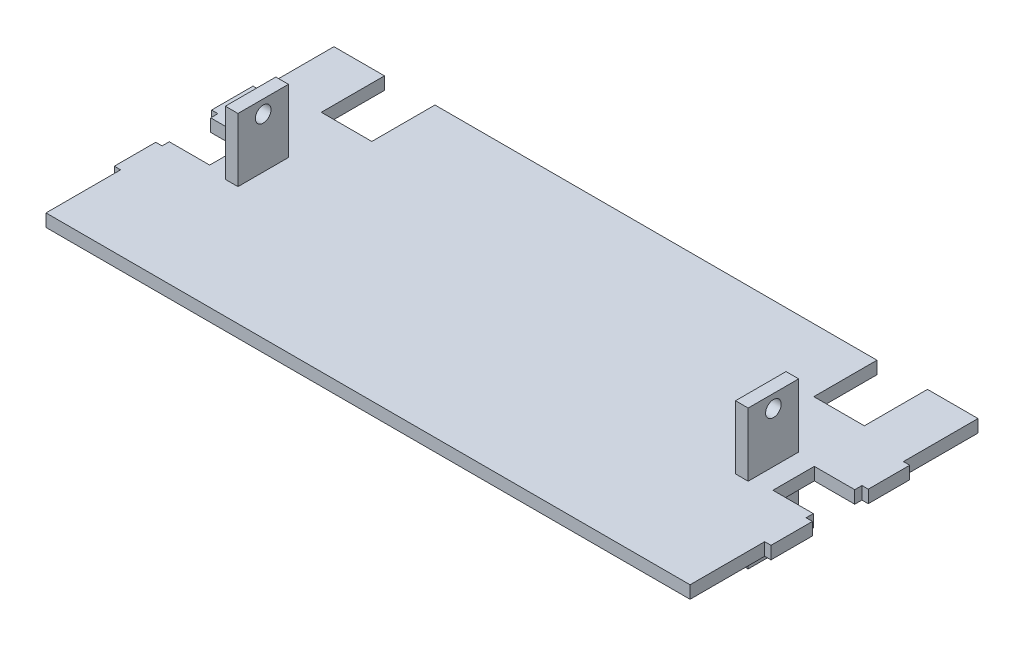
from build123d import *

# Parameters (mm, degrees)
BOSS_EXTRUDE1_DEPTH     = 3.175
SKETCH2_W               = 6.35
SKETCH2_H               = 25.4
BOSS_EXTRUDE2_DEPTH     = 35.052
CUT_EXTRUDE1_DEPTH      = 308.258672504
CUT_EXTRUDE1_DEPTH_BACK = 308.258672504
SKETCH3_R               = 3.937


with BuildPart() as part:
    # Sketch1 → Boss-Extrude1 (new, symmetric)
    with BuildSketch(Plane(origin=(0, 0, 0), x_dir=(1, 0, 0), z_dir=(0, 1, 0))):
        Polygon((161.925, -72.39), (-161.925, -72.39), (-161.925, -34.874677354), (-165.1, -34.874677354), (-165.1, -14.046677354), (-161.925, -14.046677354), (-161.925, -10.414), (-141.605, -10.414), (-141.605, 10.414), (-161.925, 10.414), (-161.925, 14.046677354), (-165.1, 14.046677354), (-165.1, 34.874677354), (-161.925, 34.874677354), (-161.925, 72.39), (-136.525, 72.39), (-136.525, 40.64), (-111.125, 40.64), (-111.125, 72.39), (111.125, 72.39), (111.125, 40.64), (136.525, 40.64), (136.525, 72.39), (161.925, 72.39), (161.925, 34.874677354), (165.1, 34.874677354), (165.1, 14.046677354), (161.925, 14.046677354), (161.925, 10.414), (141.605, 10.414), (141.605, -10.414), (161.925, -10.414), (161.925, -14.046677354), (165.1, -14.046677354), (165.1, -34.874677354), (161.925, -34.874677354), align=None)
    extrude(amount=BOSS_EXTRUDE1_DEPTH, both=True)

    # Sketch2 → Boss-Extrude2 (add, symmetric)
    with BuildSketch(Plane(origin=(0, 0, 0), x_dir=(1, 0, 0), z_dir=(0, 1, 0))):
        with Locations((128.27, 0)):
            Rectangle(SKETCH2_W, SKETCH2_H)
        with Locations((-128.27, 0)):
            Rectangle(SKETCH2_W, SKETCH2_H)
    extrude(amount=BOSS_EXTRUDE2_DEPTH, both=True)

    # Sketch3 → Cut-Extrude1 (cut, two sides: drawn at the far end of the back side and taken through both)
    with BuildSketch(Plane.ZY.offset(131.445).offset(-CUT_EXTRUDE1_DEPTH_BACK)):
        with Locations((0, 28.440626924)):
            Circle(SKETCH3_R)
        with Locations((0, -28.440626924)):
            Circle(SKETCH3_R)
    extrude(amount=CUT_EXTRUDE1_DEPTH + CUT_EXTRUDE1_DEPTH_BACK, mode=Mode.SUBTRACT)


solid = part.part
